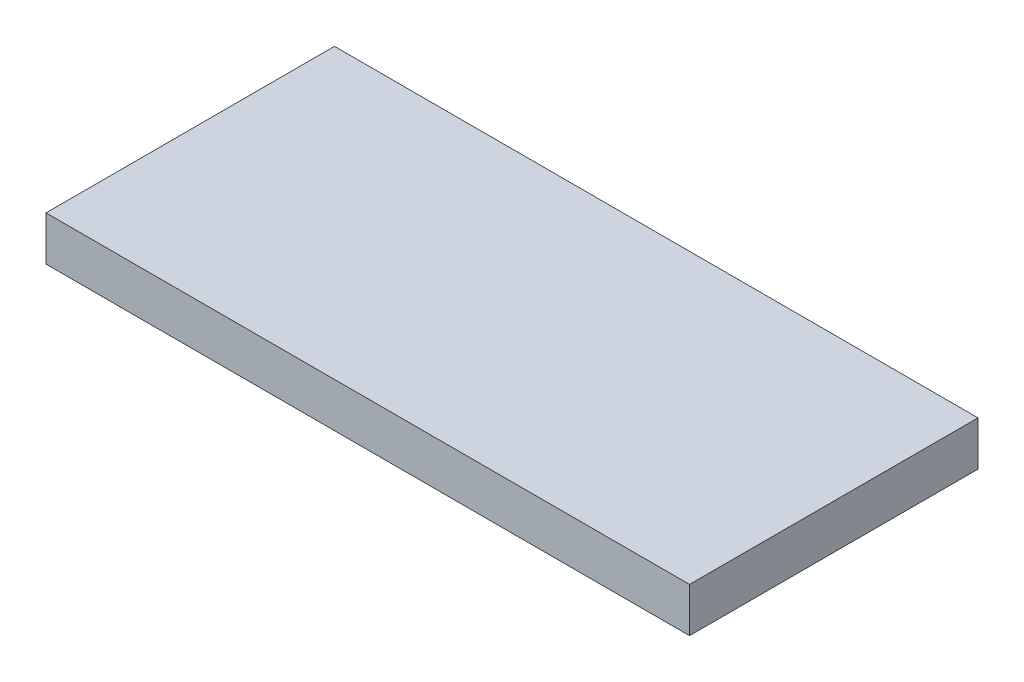
from build123d import *

# Parameters (mm, degrees)
SKETCH1_W           = 29
SKETCH1_H           = 13
BOSS_EXTRUDE1_DEPTH = 2


with BuildPart() as part:
    # Sketch1 → Boss-Extrude1 (new body)
    with BuildSketch(Plane(origin=(0, 0, 0), x_dir=(1, 0, 0), z_dir=(0, 1, 0))):
        Rectangle(SKETCH1_W, SKETCH1_H)
    extrude(amount=BOSS_EXTRUDE1_DEPTH)


solid = part.part
